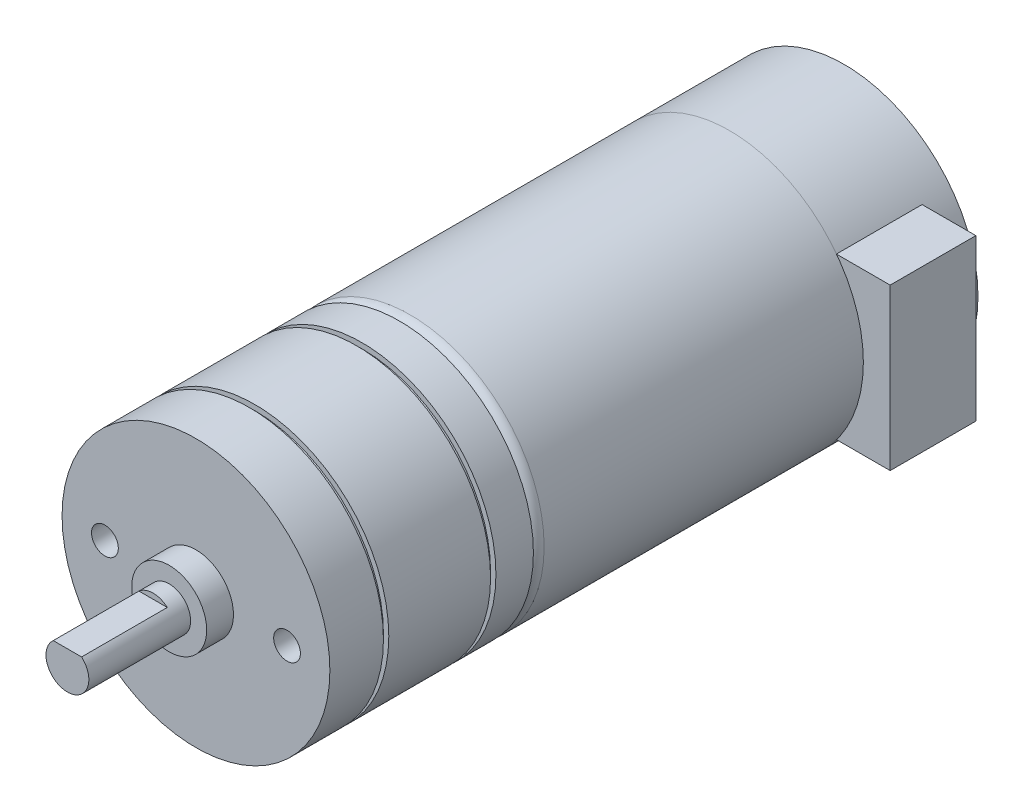
from build123d import *

# Parameters (mm, degrees)
SKETCH_1_R             = 12.5
EXTRUDE_1_DEPTH        = 30.8
SKETCH_2_R             = 12.5
EXTRUDE_2_DEPTH        = 10.7
SKETCH_3_W             = 8
SKETCH_3_H             = 15
EXTRUDE_3_DEPTH        = 15
FILLET_1_R             = 1
SKETCH_4_R             = 12.5
EXTRUDE_4_DEPTH        = 19
CUT_EXTRUDE_START      = -15.5
SKETCH_5_R             = 12.5
SKETCH_5_R_2           = 12
CUT_EXTRUDE_1_DEPTH    = 0.5
PATTERN_LINEAR_1_COUNT = 2
PATTERN_LINEAR_1_PITCH = 10
SKETCH_6_R             = 3.5
EXTRUDE_5_DEPTH        = 2.5
SKETCH_7_R             = 2
EXTRUDE_6_DEPTH        = 9.5
CUT_EXTRUDE_2_DEPTH    = 8
M3X0_5_1_AT_2_COUNT    = 2
M3X0_5_1_AT_2_PITCH    = 17


with BuildPart() as part:
    # 草圖1 → 填料-伸長1 (new body)
    with BuildSketch(Plane.XY):
        Circle(SKETCH_1_R)
    extrude(amount=EXTRUDE_1_DEPTH)

    # 圓角1
    fillet_1_edges = [part.edges().sort_by_distance(p)[0] for p in [
        (-12.5, 0, 30.8),
    ]]
    fillet(fillet_1_edges, radius=FILLET_1_R)


with BuildPart() as body_2:
    # 草圖2 → 填料-伸長2 (new body)
    with BuildSketch(Plane(origin=(0, 0, 0), x_dir=(-1, 0, 0), z_dir=(0, 0, -1))):
        Circle(SKETCH_2_R)
    extrude(amount=EXTRUDE_2_DEPTH)


with BuildPart() as body_3:
    # 草圖3 → 填料-伸長3 (new body)
    with BuildSketch(Plane(origin=(0, 0, 0), x_dir=(0, 0, -1), z_dir=(1, 0, 0))):
        with Locations((4, 0)):
            Rectangle(SKETCH_3_W, SKETCH_3_H)
    extrude(amount=EXTRUDE_3_DEPTH)


with BuildPart() as body_4:
    # 草圖4 → 填料-伸長4 (new body)
    with BuildSketch(Plane.XY.offset(30.8)):
        Circle(SKETCH_4_R)
    extrude(amount=EXTRUDE_4_DEPTH)

    # 草圖5 → 除料-伸長1 (cut)
    with BuildSketch(Plane.XY.offset(49.8).offset(CUT_EXTRUDE_START)):
        Circle(SKETCH_5_R)
        Circle(SKETCH_5_R_2, mode=Mode.SUBTRACT)
    cut_extrude_1 = extrude(amount=CUT_EXTRUDE_1_DEPTH, mode=Mode.SUBTRACT)

    # 直線複製排列1: 除料-伸長1 ×2
    with Locations(*[(0, 0, i * PATTERN_LINEAR_1_PITCH) for i in range(1, PATTERN_LINEAR_1_COUNT)]):
        add(cut_extrude_1, mode=Mode.SUBTRACT)

    # 草圖12 → M3x0.5 螺紋孔1 (revolve, cut)
    with BuildSketch(Plane(origin=(8.5, 0, 49.8), x_dir=(0, -1, 0), z_dir=(1, 0, 0))):
        Polygon((0, 0), (0, 5.751075774), (1.25, 5), (1.25, 0), align=None)
    m3x0_5_1 = revolve(axis=Axis((8.5, 0, 56.15), (0, 0, -1)), mode=Mode.SUBTRACT)

    # M3x0.5 螺紋孔1 at 2: M3x0.5 螺紋孔1 ×2
    with Locations(*[(-i * M3X0_5_1_AT_2_PITCH, 0, 0) for i in range(1, M3X0_5_1_AT_2_COUNT)]):
        add(m3x0_5_1, mode=Mode.SUBTRACT)


with BuildPart() as body_5:
    # 草圖6 → 填料-伸長5 (new body)
    with BuildSketch(Plane.XY.offset(49.8)):
        Circle(SKETCH_6_R)
    extrude(amount=EXTRUDE_5_DEPTH)

    # 草圖7 → 填料-伸長6 (add)
    with BuildSketch(Plane.XY.offset(52.3)):
        Circle(SKETCH_7_R)
    extrude(amount=EXTRUDE_6_DEPTH)

    # 草圖8 → 除料-伸長2 (cut)
    with BuildSketch(Plane.XY.offset(61.8)):
        with BuildLine():
            ThreePointArc((1.322875656, 1.5), (0, 2), (-1.322875656, 1.5))
            Line((-1.322875656, 1.5), (1.322875656, 1.5))
        make_face()
    extrude(amount=-CUT_EXTRUDE_2_DEPTH, mode=Mode.SUBTRACT)


solid = Compound([part.part, body_2.part, body_3.part, body_4.part, body_5.part])
